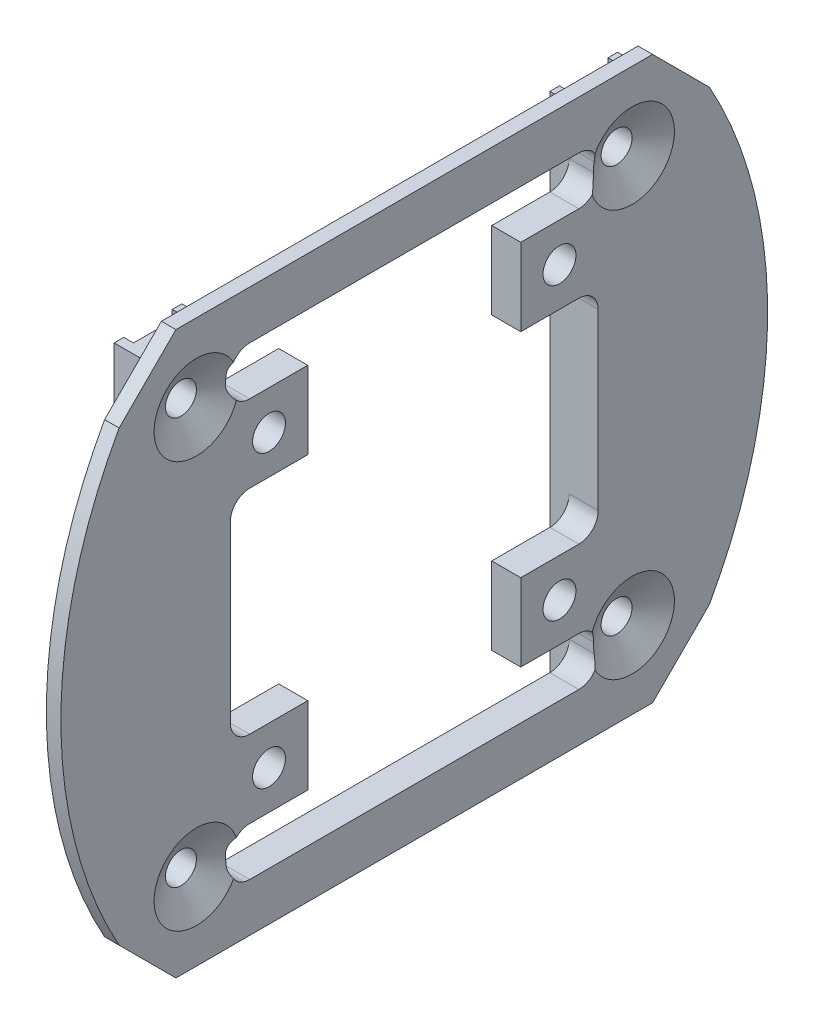
from build123d import *

# Parameters (mm, degrees)
SKETCH_1_W                  = 58
SKETCH_1_H                  = 58
SKETCH_1_R                  = 1.7
EXTRUDE_1_DEPTH             = 5
SKETCH_2_W                  = 58
SKETCH_2_H                  = 58
SKETCH_2_W_2                = 52
SKETCH_2_H_2                = 52
CUT_EXTRUDE_1_DEPTH         = 3.5
SKETCH_3_W                  = 38
SKETCH_3_H                  = 52
CUT_EXTRUDE_2_DEPTH         = 2
SKETCH_4_W                  = 5
SKETCH_4_H                  = 52
CUT_EXTRUDE_3_DEPTH         = 1
SKETCH_8_R                  = 1.6
CUT_EXTRUDE_4_DEPTH         = 2.4
PATTERN_LINEAR_1_COUNT      = 2
PATTERN_LINEAR_1_PITCH      = 45
PATTERN_LINEAR_1_COUNT_DIR2 = 2
PATTERN_LINEAR_1_PITCH_DIR2 = 42
EXTRUDE_2_DEPTH             = 1.5
SKETCH_12_R                 = 63.004873171
CUT_EXTRUDE_6_DEPTH         = 1.5
CHAMFER_2_SIZE              = 2
CHAMFER_3_SIZE              = 2
CHAMFER_5_SIZE              = 2
CHAMFER_6_SIZE              = 2


with BuildPart() as part:
    # 草图1 → 凸台-拉伸1 (new body)
    with BuildSketch(Plane(origin=(0, 0, 0), x_dir=(0, 0, -1), z_dir=(1, 0, 0))):
        Rectangle(SKETCH_1_W, SKETCH_1_H)
        with Locations((15, 15)):
            Circle(SKETCH_1_R, mode=Mode.SUBTRACT)
        with Locations(Location((-15, 15, 0), (0, 0, 180))):
            Circle(SKETCH_1_R, mode=Mode.SUBTRACT)
        with Locations((-15, -15)):
            Circle(SKETCH_1_R, mode=Mode.SUBTRACT)
        with Locations(Location((15, -15, 0), (0, 0, 180))):
            Circle(SKETCH_1_R, mode=Mode.SUBTRACT)
        with BuildLine():
            Line((-17, 24), (17, 24))
            ThreePointArc((17, 24), (18.414213562, 23.414213562), (19, 22))
            Line((19, 22), (19, 21))
            ThreePointArc((19, 21), (18.414213562, 19.585786438), (17, 19))
            Line((17, 19), (11, 19))
            Line((11, 19), (11, 11))
            Line((11, 11), (17, 11))
            ThreePointArc((17, 11), (18.414213562, 10.414213562), (19, 9))
            Line((19, 9), (19, -9))
            ThreePointArc((19, -9), (18.414213562, -10.414213562), (17, -11))
            Line((17, -11), (11, -11))
            Line((11, -11), (11, -19))
            Line((11, -19), (17, -19))
            ThreePointArc((17, -19), (18.414213562, -19.585786438), (19, -21))
            Line((19, -21), (19, -22))
            ThreePointArc((19, -22), (18.414213562, -23.414213562), (17, -24))
            Line((17, -24), (-17, -24))
            ThreePointArc((-17, -24), (-18.414213562, -23.414213562), (-19, -22))
            Line((-19, -22), (-19, -21))
            ThreePointArc((-19, -21), (-18.414213562, -19.585786438), (-17, -19))
            Line((-17, -19), (-11, -19))
            Line((-11, -19), (-11, -11))
            Line((-11, -11), (-17, -11))
            ThreePointArc((-17, -11), (-18.414213562, -10.414213562), (-19, -9))
            Line((-19, -9), (-19, 9))
            ThreePointArc((-19, 9), (-18.414213562, 10.414213562), (-17, 11))
            Line((-17, 11), (-11, 11))
            Line((-11, 11), (-11, 19))
            Line((-11, 19), (-17, 19))
            ThreePointArc((-17, 19), (-18.414213562, 19.585786438), (-19, 21))
            Line((-19, 21), (-19, 22))
            ThreePointArc((-19, 22), (-18.414213562, 23.414213562), (-17, 24))
        make_face(mode=Mode.SUBTRACT)
    extrude(amount=EXTRUDE_1_DEPTH)

    # 草图2 → 切除-拉伸1 (cut)
    with BuildSketch(Plane.ZY):
        Rectangle(SKETCH_2_W, SKETCH_2_H)
        Rectangle(SKETCH_2_W_2, SKETCH_2_H_2, mode=Mode.SUBTRACT)
    extrude(amount=-CUT_EXTRUDE_1_DEPTH, mode=Mode.SUBTRACT)

    # 草图3 → 切除-拉伸2 (cut)
    with BuildSketch(Plane.ZY):
        Rectangle(SKETCH_3_W, SKETCH_3_H)
    extrude(amount=-CUT_EXTRUDE_2_DEPTH, mode=Mode.SUBTRACT)

    # 草图4 → 切除-拉伸3 (cut)
    with BuildSketch(Plane.ZY):
        with Locations((-22.5, 0)):
            Rectangle(SKETCH_4_W, SKETCH_4_H)
        with Locations((22.5, 0)):
            Rectangle(SKETCH_4_W, SKETCH_4_H)
    extrude(amount=-CUT_EXTRUDE_3_DEPTH, mode=Mode.SUBTRACT)

    # 草图8 → 切除-拉伸4 (cut)
    with BuildSketch(Plane.ZY.offset(-1)):
        with Locations((22.5, 21)):
            Circle(SKETCH_8_R)
    cut_extrude_4 = extrude(amount=-CUT_EXTRUDE_4_DEPTH, mode=Mode.SUBTRACT)

    # 草图9 → 切除-旋转2 (revolve, cut)
    with BuildSketch(Plane.XY.offset(22.5), mode=Mode.PRIVATE) as cut_revolve_2_sk:
        Polygon((3.4, 19.4), (3.4, 21), (5, 21), (5, 16.628718708), align=None)
    cut_revolve_2 = revolve(cut_revolve_2_sk.sketch.rotate(Axis((3.417252413, 21, 22.5), (1, 0, 0)), 90), axis=Axis((3.417252413, 21, 22.5), (1, 0, 0)), mode=Mode.SUBTRACT)

    # 阵列(线性)1: 切除-拉伸4, Cut-Revolve 2 2 × 2
    with Locations(*[(0, -j * PATTERN_LINEAR_1_PITCH_DIR2, -i * PATTERN_LINEAR_1_PITCH) for i in range(PATTERN_LINEAR_1_COUNT) for j in range(PATTERN_LINEAR_1_COUNT_DIR2) if (i, j) != (0, 0)]):
        add(cut_extrude_4, mode=Mode.SUBTRACT)
        add(cut_revolve_2, mode=Mode.SUBTRACT)

    # 草图10 → 凸台-拉伸2 (add)
    with BuildSketch(Plane(origin=(5, 0, 0), x_dir=(0, 0, -1), z_dir=(1, 0, 0))):
        with BuildLine():
            Line((-29, 25.617376915), (-29, -25.617376915))
            ThreePointArc((-29, -25.617376915), (-36.5, 0), (-29, 25.617376915))
        make_face()
        with BuildLine():
            Line((29, 25.617376915), (29, -25.617376915))
            ThreePointArc((29, -25.617376915), (36.5, 0), (29, 25.617376915))
        make_face()
    extrude(amount=-EXTRUDE_2_DEPTH)

    # 草图12 → 切除-拉伸6 (cut)
    with BuildSketch(Plane(origin=(5, 0, 0), x_dir=(0, 0, -1), z_dir=(1, 0, 0))):
        Circle(SKETCH_12_R)
        with BuildLine():
            ThreePointArc((0, -46.208765402), (36.5, 0), (0, 46.208765402))
            ThreePointArc((0, 46.208765402), (-36.5, 0), (0, -46.208765402))
        make_face(mode=Mode.SUBTRACT)
    extrude(amount=-CUT_EXTRUDE_6_DEPTH, mode=Mode.SUBTRACT)

    # 倒角2
    # the kernel refuses this chamfer: 11.02112637, 2 mm, written as the material it takes off along each edge
    with BuildSketch(Plane(origin=(-15.143908505, 29, 26.619808612), x_dir=(0, 0, -1), z_dir=(1, 0, 0))) as chamfer_2_piece_1:
        with BuildLine():
            Line((CHAMFER_2_SIZE, 0), (-3.865883602, -5.865883602))
            ThreePointArc((-3.865883602, -5.865883602), (-2.160150245, -3.0422483), (0, 0))
            Line((0, 0), (CHAMFER_2_SIZE, 0))
        make_face()
    extrude(amount=38.787817011, mode=Mode.SUBTRACT)

    # 倒角3
    # the kernel refuses this chamfer: 11.02112637, 2 mm, written as the material it takes off along each edge
    with BuildSketch(Plane(origin=(-15.143908505, 29, -26.619808612), x_dir=(0, 0, 1), z_dir=(1, 0, 0))) as chamfer_3_piece_1:
        with BuildLine():
            Line((CHAMFER_3_SIZE, 0), (-3.865883602, 5.865883602))
            ThreePointArc((-3.865883602, 5.865883602), (-2.160150245, 3.0422483), (0, 0))
            Line((0, 0), (CHAMFER_3_SIZE, 0))
        make_face()
    extrude(amount=38.787817011, mode=Mode.SUBTRACT)

    # 倒角5
    # the kernel refuses this chamfer: 11.02112637, 2 mm, written as the material it takes off along each edge
    with BuildSketch(Plane(origin=(-15.143908505, -29, -26.619808612), x_dir=(0, 0, 1), z_dir=(1, 0, 0))) as chamfer_5_piece_1:
        with BuildLine():
            Line((CHAMFER_5_SIZE, 0), (-3.865883602, -5.865883602))
            ThreePointArc((-3.865883602, -5.865883602), (-2.160150245, -3.0422483), (0, 0))
            Line((0, 0), (CHAMFER_5_SIZE, 0))
        make_face()
    extrude(amount=38.787817011, mode=Mode.SUBTRACT)

    # 倒角6
    # the kernel refuses this chamfer: 11.02112637, 2 mm, written as the material it takes off along each edge
    with BuildSketch(Plane(origin=(-15.143908505, -29, 26.619808612), x_dir=(0, 0, -1), z_dir=(1, 0, 0))) as chamfer_6_piece_1:
        with BuildLine():
            Line((CHAMFER_6_SIZE, 0), (-3.865883602, 5.865883602))
            ThreePointArc((-3.865883602, 5.865883602), (-2.160150245, 3.0422483), (0, 0))
            Line((0, 0), (CHAMFER_6_SIZE, 0))
        make_face()
    extrude(amount=38.787817011, mode=Mode.SUBTRACT)


solid = part.part
